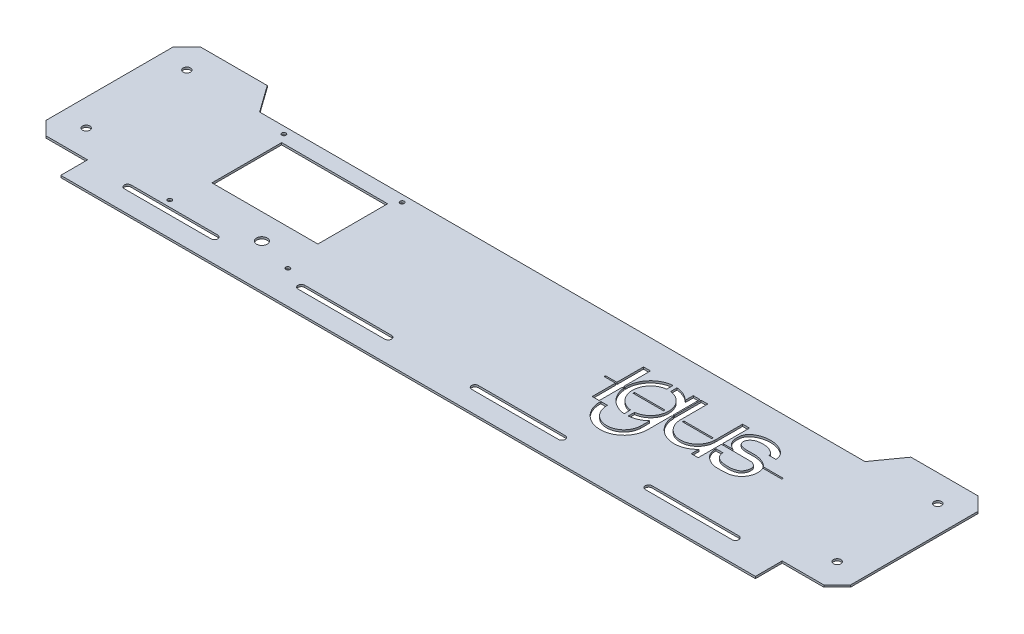
from build123d import *

# Parameters (mm, degrees)
SKETCH1_R           = 2.75
BOSS_EXTRUDE1_DEPTH = 1.5
CUT_EXTRUDE1_DEPTH  = 494
SKETCH3_W           = 79
SKETCH3_H           = 52
CUT_EXTRUDE2_DEPTH  = 10
SKETCH7_R           = 4
CUT_EXTRUDE4_DEPTH  = 10
SKETCH8_R           = 1.525
CUT_EXTRUDE5_DEPTH  = 10
BOSS_EXTRUDE2_DEPTH = 1.5


with BuildPart() as part:
    # Sketch1 → Boss-Extrude1 (new body)
    with BuildSketch(Plane(origin=(0, 0, 0), x_dir=(1, 0, 0), z_dir=(0, 1, 0))):
        Polygon((14.619315376, -0.395174927), (64.619315376, -0.395174927), (78.894940901, -20.395174927), (530.343689851, -20.395174927), (544.619315376, -0.395174927), (594.619315376, -0.395174927), (604.619315376, -10.395174927), (604.619315376, -105.395174927), (594.619315376, -115.395174927), (563.619315376, -115.395174927), (563.619315376, -135.395174927), (45.619315376, -135.395174927), (45.619315376, -115.395174927), (14.619315376, -115.395174927), (4.619315376, -105.395174927), (4.619315376, -10.395174927), align=None)
        with Locations(Location((24.619315376, -20.395174927, 0), (0, 0, 270))):
            Circle(SKETCH1_R, mode=Mode.SUBTRACT)
        with Locations(Location((24.619315376, -95.395174927, 0), (0, 0, 270))):
            Circle(SKETCH1_R, mode=Mode.SUBTRACT)
        with Locations(Location((584.619315376, -95.395174927, 0), (0, 0, 90))):
            Circle(SKETCH1_R, mode=Mode.SUBTRACT)
        with Locations(Location((584.619315376, -20.395174927, 0), (0, 0, 90))):
            Circle(SKETCH1_R, mode=Mode.SUBTRACT)
        with BuildLine():
            Line((142.744315376, -120.395174927), (77.994315376, -120.395174927))
            ThreePointArc((77.994315376, -120.395174927), (75.494315376, -117.895174927), (77.994315376, -115.395174927))
            Line((77.994315376, -115.395174927), (142.744315376, -115.395174927))
            ThreePointArc((142.744315376, -115.395174927), (145.244315376, -117.895174927), (142.744315376, -120.395174927))
        make_face(mode=Mode.SUBTRACT)
        with BuildLine():
            Line((466.494315376, -115.395174927), (531.244315376, -115.395174927))
            ThreePointArc((531.244315376, -115.395174927), (533.744315376, -117.895174927), (531.244315376, -120.395174927))
            Line((531.244315376, -120.395174927), (466.494315376, -120.395174927))
            ThreePointArc((466.494315376, -120.395174927), (463.994315376, -117.895174927), (466.494315376, -115.395174927))
        make_face(mode=Mode.SUBTRACT)
        with BuildLine():
            Line((336.994315376, -115.395174927), (401.744315376, -115.395174927))
            ThreePointArc((401.744315376, -115.395174927), (404.244315376, -117.895174927), (401.744315376, -120.395174927))
            Line((401.744315376, -120.395174927), (336.994315376, -120.395174927))
            ThreePointArc((336.994315376, -120.395174927), (334.494315376, -117.895174927), (336.994315376, -115.395174927))
        make_face(mode=Mode.SUBTRACT)
        with BuildLine():
            Line((207.494315376, -115.395174927), (272.244315376, -115.395174927))
            ThreePointArc((272.244315376, -115.395174927), (274.744315376, -117.895174927), (272.244315376, -120.395174927))
            Line((272.244315376, -120.395174927), (207.494315376, -120.395174927))
            ThreePointArc((207.494315376, -120.395174927), (204.994315376, -117.895174927), (207.494315376, -115.395174927))
        make_face(mode=Mode.SUBTRACT)
    extrude(amount=BOSS_EXTRUDE1_DEPTH)

    # Sketch2 → Cut-Extrude1 (cut)
    # profile 1 of 2: a face of its own
    with BuildSketch(Plane(origin=(0, 1.5, 0), x_dir=(1, 0, 0), z_dir=(0, 1, 0))):
        with BuildLine():
            Line((391.847895604, -62.754542196), (392.8951588, -62.754542196))
            ThreePointArc((392.8951588, -62.754542196), (404.702292582, -78.183742443), (423.738270438, -74.297848013))
            Line((423.738270438, -74.297848013), (423.738270438, -81.184295825))
            ThreePointArc((423.738270438, -81.184295825), (410.316456421, -93.498633134), (398.002119112, -80.076819118))
            Line((398.002119112, -80.076819118), (393.00270081, -80.076819118))
            ThreePointArc((393.00270081, -80.076819118), (410.316456421, -98.498051436), (428.73768874, -81.184295825))
            Line((428.73768874, -81.184295825), (428.73768874, -41.8474518))
            Line((428.73768874, -41.8474518), (423.738270438, -41.8474518))
            Line((423.738270438, -41.8474518), (423.738270438, -47.786335651))
            ThreePointArc((423.738270438, -47.786335651), (403.611105615, -44.349438795), (392.826248922, -61.687313229))
            Line((392.826248922, -61.687313229), (391.847895604, -61.687313229))
            Line((391.847895604, -61.687313229), (391.847895604, -41.847451799))
            Line((391.847895604, -41.847451799), (386.612349176, -41.847451799))
            Line((386.612349176, -41.847451799), (386.612349176, -61.687313229))
            Line((386.612349176, -61.687313229), (378.212990315, -61.687313229))
            Line((378.212990315, -61.687313229), (378.212990315, -62.754542196))
            Line((378.212990315, -62.754542196), (386.612349176, -62.754542196))
            Line((386.612349176, -62.754542196), (386.612349176, -80.076819118))
            Line((386.612349176, -80.076819118), (391.847895604, -80.076819118))
            Line((391.847895604, -80.076819118), (391.847895604, -62.754542196))
        make_face()
        with BuildLine():
            ThreePointArc((424.630340047, -61.687313229), (411.117706096, -47.514062156), (397.605072146, -61.687313229))
            Line((397.605072146, -61.687313229), (424.630340047, -61.687313229))
        make_face(mode=Mode.SUBTRACT)
        with BuildLine():
            ThreePointArc((397.698499686, -62.754542196), (411.117706096, -74.570121508), (424.536912506, -62.754542196))
            Line((424.536912506, -62.754542196), (397.698499686, -62.754542196))
        make_face(mode=Mode.SUBTRACT)
    # profile 2 of 2: a face of its own
    with BuildSketch(Plane(origin=(0, 1.5, 0), x_dir=(1, 0, 0), z_dir=(0, 1, 0))):
        with BuildLine():
            Line((428.73768874, -61.687313229), (428.73768874, -62.754542196))
            Line((428.73768874, -62.754542196), (429.828410223, -62.754542196))
            ThreePointArc((429.828410223, -62.754542196), (441.263270171, -78.892317867), (460.524654776, -74.399780865))
            Line((460.524654776, -74.399780865), (460.524654776, -80.076819118))
            Line((460.524654776, -80.076819118), (465.660554794, -80.076819118))
            Line((465.660554794, -80.076819118), (465.660554794, -62.754542196))
            Line((465.660554794, -62.754542196), (488.417944181, -62.855108717))
            add(Edge.make_bspline(
                [(471.65979143, -67.670234055), (471.467349037, -68.646289122), (472.079971263, -69.787073511), (472.75073467, -71.328334093), (473.670793108, -72.142703983), (474.731506552, -73.17837262), (476.26675861, -73.965460053), (478.30593381, -74.512399305), (480.63667293, -74.705574625), (483.281199386, -74.769793815), (485.889933101, -74.527747245), (488.211391914, -73.733498343), (490.455228526, -72.719383895), (491.526175492, -70.590370359), (492.370540737, -68.546977205), (492.272585959, -66.544136837), (491.572707864, -64.014873745), (489.373868115, -63.411195717), (488.417944181, -62.855108717)],
                knots=[0, 0, 0, 0, 0.081184108, 0.10790483, 0.143900876, 0.185103716, 0.23586594, 0.290215762, 0.366526158, 0.436729253, 0.51873906, 0.590001951, 0.649430214, 0.723575416, 0.786665555, 0.838093389, 0.894821875, 1, 1, 1, 1], degree=3))
            Line((471.65979143, -67.670234055), (466.527025714, -67.670234055))
            add(Edge.make_bspline(
                [(496.465712365, -62.754542196), (496.556977024, -62.920783862), (497.154806756, -64.113814796), (497.675924436, -66.848005681), (497.311914035, -70.780078344), (495.575446493, -74.301968213), (492.98720979, -77.098696092), (489.940908772, -78.771690205), (486.694478373, -79.50921288), (483.053674793, -79.684304385), (479.203565525, -79.74368695), (475.393522247, -79.36720183), (472.390086365, -77.723772723), (469.576953675, -75.999956627), (467.190123208, -72.425986535), (466.247518724, -69.586943049), (466.527025714, -67.670234055)],
                knots=[0.511379909, 0.511379909, 0.511379909, 0.511379909, 0.516990878, 0.550897762, 0.592186626, 0.63231135, 0.665073685, 0.704086852, 0.733344431, 0.763283971, 0.812029986, 0.848328531, 0.874618577, 0.91298076, 0.944693495, 1, 1, 1, 1], degree=3))
            Line((496.465712365, -62.754542196), (510.681758941, -62.754542196))
            Line((510.681758941, -62.754542196), (510.681758941, -61.687313229))
            Line((510.681758941, -61.687313229), (495.762116862, -61.687313229))
            add(Edge.make_bspline(
                [(490.38889617, -52.214376993), (490.666192943, -51.358432785), (489.79050483, -50.022415821), (487.932067858, -48.843148452), (485.54645635, -47.510297539), (482.562260426, -47.043421476), (479.134677609, -47.158975955), (476.068218203, -47.614807116), (473.488258648, -49.377581885), (472.04812259, -51.653010333), (471.984618877, -54.16781745), (473.478287973, -55.992395301), (477.47064832, -57.607026677), (483.363758542, -56.560367271), (489.741283998, -57.625951926), (493.725072166, -59.531757921), (495.302235724, -61.095199397), (495.762116862, -61.687313229)],
                knots=[0, 0, 0, 0, 0.023973978, 0.04290032, 0.065706797, 0.10450496, 0.130316026, 0.168033853, 0.194385522, 0.220521746, 0.245718615, 0.26280001, 0.287259547, 0.369622478, 0.434467432, 0.476788021, 0.498807658, 0.498807658, 0.498807658, 0.498807658], degree=3))
            Line((490.38889617, -52.214376993), (495.664673576, -52.214376993))
            add(Edge.make_bspline(
                [(495.664673576, -52.214376993), (495.919639332, -48.412828628), (490.437193219, -42.931253515), (480.799393591, -41.213342373), (473.004306785, -43.124237957), (467.515587473, -47.653871227), (467.024877851, -52.639692563), (467.80487049, -58.095251596), (470.959295633, -60.815942731), (473.382272533, -61.687313229)],
                knots=[0, 0, 0, 0, 0.214336098, 0.393230308, 0.565847142, 0.676110279, 0.787926735, 0.842679623, 1, 1, 1, 1], degree=3))
            Line((473.382272533, -61.687313229), (465.660554794, -61.687313229))
            Line((465.660554794, -61.687313229), (465.660554794, -41.847451799))
            Line((465.660554794, -41.847451799), (460.524654776, -41.847451799))
            Line((460.524654776, -41.847451799), (460.524654776, -61.687313229))
            Line((460.524654776, -61.687313229), (434.585527347, -61.687313229))
            Line((434.585527347, -61.687313229), (434.585527347, -41.8474518))
            Line((434.585527347, -41.8474518), (429.6271558, -41.8474518))
            Line((429.6271558, -41.8474518), (429.6271558, -61.687313229))
            Line((429.6271558, -61.687313229), (428.73768874, -61.687313229))
        make_face()
        with BuildLine():
            ThreePointArc((460.51725233, -62.754542196), (447.551695765, -75.289313484), (434.586139201, -62.754542196))
            Line((434.586139201, -62.754542196), (460.51725233, -62.754542196))
        make_face(mode=Mode.SUBTRACT)
    extrude(amount=-CUT_EXTRUDE1_DEPTH, mode=Mode.SUBTRACT)


with BuildPart() as cut_extrude1_piece_1:
    # of the separate pieces the step leaves, piece 1, a body of its own (cut_extrude1_pieces)
    add(part.part.solids().sort_by_distance((14.619315376, 0, 0.395174927))[0])

    # Sketch3 → Cut-Extrude2 (cut)
    with BuildSketch(Plane(origin=(0, 1.5, 0), x_dir=(1, 0, 0), z_dir=(0, 1, 0))):
        with Locations((146.360700612, -57.895174927)):
            Rectangle(SKETCH3_W, SKETCH3_H)
    extrude(amount=-CUT_EXTRUDE2_DEPTH, mode=Mode.SUBTRACT)

    # Sketch7 → Cut-Extrude4 (cut)
    with BuildSketch(Plane(origin=(0, 1.5, 0), x_dir=(1, 0, 0), z_dir=(0, 1, 0))):
        with Locations(Location((163.085700612, -102.845174927, 0), (0, 0, 270))):
            Circle(SKETCH7_R)
    extrude(amount=-CUT_EXTRUDE4_DEPTH, mode=Mode.SUBTRACT)

    # Sketch8 → Cut-Extrude5 (cut)
    with BuildSketch(Plane(origin=(0, 0, 0), x_dir=(-1, 0, 0), z_dir=(0, -1, 0))):
        with Locations(Location((-190.355700612, -25.580174927, 0), (0, 0, 90))):
            Circle(SKETCH8_R)
        with Locations(Location((-102.205700612, -25.580174927, 0), (0, 0, 90))):
            Circle(SKETCH8_R)
        with Locations(Location((-102.205700612, -110.710174927, 0), (0, 0, 90))):
            Circle(SKETCH8_R)
        with Locations(Location((-190.355700612, -110.710174927, 0), (0, 0, 90))):
            Circle(SKETCH8_R)
    extrude(amount=-CUT_EXTRUDE5_DEPTH, mode=Mode.SUBTRACT)



with BuildPart() as cut_extrude1_piece_2:
    # of the separate pieces the step leaves, piece 2, a body of its own (cut_extrude1_pieces)
    add(part.part.solids().sort_by_distance((424.630340047, 0, 61.687313229))[0])


with BuildPart() as cut_extrude1_piece_3:
    # of the separate pieces the step leaves, piece 3, a body of its own (cut_extrude1_pieces)
    add(part.part.solids().sort_by_distance((434.586139201, 0, 62.754542196))[0])


with BuildPart() as cut_extrude1_piece_4:
    # of the separate pieces the step leaves, piece 4, a body of its own (cut_extrude1_pieces)
    add(part.part.solids().sort_by_distance((397.698499686, 0, 62.754542196))[0])


with BuildPart() as cut_extrude1_piece_1_1:
    add(cut_extrude1_piece_1.part)

    add(cut_extrude1_piece_2.part)  # Boss-Extrude2 merges Cut-Extrude1 piece 2

    add(cut_extrude1_piece_3.part)  # Boss-Extrude2 merges Cut-Extrude1 piece 3

    add(cut_extrude1_piece_4.part)  # Boss-Extrude2 merges Cut-Extrude1 piece 4
    # Sketch9 → Boss-Extrude2 (add)
    with BuildSketch(Plane(origin=(0, 1.5, 0), x_dir=(1, 0, 0), z_dir=(0, 1, 0))):
        with BuildLine():
            Line((409.617706096, -42.800827725), (409.617706096, -47.597480015))
            ThreePointArc((409.617706096, -47.597480015), (411.117706096, -47.514062156), (412.617706096, -47.597480015))
            Line((412.617706096, -47.597480015), (412.617706096, -42.800827725))
            ThreePointArc((412.617706096, -42.800827725), (411.117706096, -42.739258275), (409.617706096, -42.800827725))
        make_face()
        with BuildLine():
            Line((422.536912506, -62.754542196), (424.536912506, -62.754542196))
            ThreePointArc((424.536912506, -62.754542196), (424.594194909, -62.221852914), (424.630340047, -61.687313229))
            Line((424.630340047, -61.687313229), (422.536912506, -61.687313229))
            Line((422.536912506, -61.687313229), (422.536912506, -62.754542196))
        make_face()
        Polygon((436.586139201, -62.754542196), (436.586139201, -61.687313229), (434.585527347, -61.687313229), (434.586139201, -62.754542196), align=None)
        Polygon((458.51725233, -61.687313229), (460.524654776, -61.687313229), (460.51725233, -62.754542196), (458.51725233, -62.754542196), align=None)
        with BuildLine():
            ThreePointArc((409.617706096, -74.48670365), (411.117706096, -74.570121508), (412.617706096, -74.48670365))
            Line((412.617706096, -74.48670365), (412.617706096, -79.283355939))
            ThreePointArc((412.617706096, -79.283355939), (411.117706096, -79.344925389), (409.617706096, -79.283355939))
            Line((409.617706096, -79.283355939), (409.617706096, -74.48670365))
        make_face()
        with BuildLine():
            ThreePointArc((397.605072146, -61.687313229), (397.641217284, -62.221852914), (397.698499686, -62.754542196))
            Line((397.698499686, -62.754542196), (399.698499686, -62.754542196))
            Line((399.698499686, -62.754542196), (399.698499686, -61.687313229))
            Line((399.698499686, -61.687313229), (397.605072146, -61.687313229))
        make_face()
    extrude(amount=-BOSS_EXTRUDE2_DEPTH)


solid = cut_extrude1_piece_1_1.part
